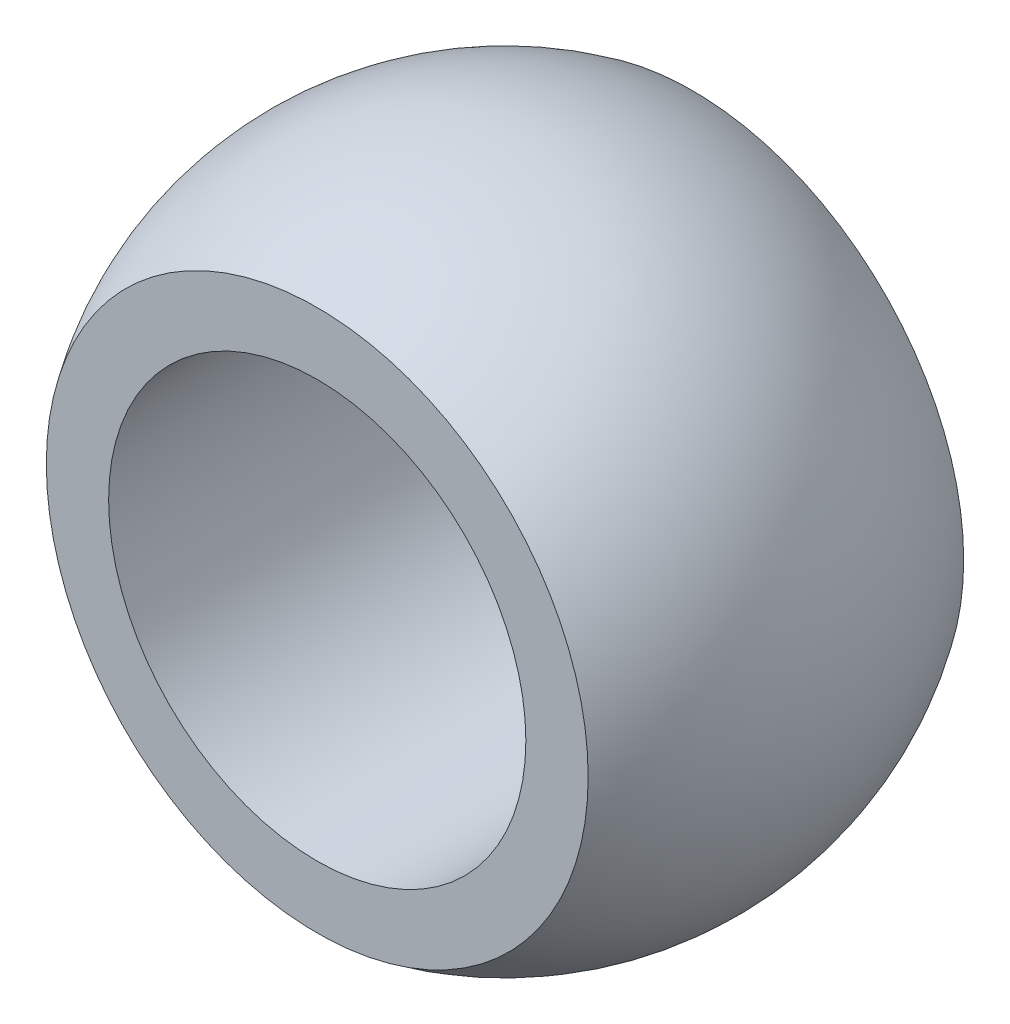
from build123d import *

# Parameters (mm, degrees)
CUT_EXTRUDE_1_DEPTH      = 10
CUT_EXTRUDE_1_DEPTH_BACK = 10
SKETCH_2_OUTSIDE_W       = 23.274
SKETCH_2_OUTSIDE_H       = 23.274
SKETCH_2_OUTSIDE_W_2     = 21.284245121
SKETCH_2_OUTSIDE_H_2     = 9
SKETCH_3_R               = 5
CUT_EXTRUDE_2_DEPTH      = 10


with BuildPart() as part:
    # 草图1 → 旋转1 (revolve)
    with BuildSketch(Plane(origin=(0, 0, 0), x_dir=(1, 0, 0), z_dir=(0, 1, 0))):
        with BuildLine():
            ThreePointArc((7.9, 0), (0, 7.9), (-7.9, 0))
            Line((-7.9, 0), (7.9, 0))
        make_face()
    revolve(axis=Axis((-7.9, 0, 0), (1, 0, 0)))

    # 草图2 outside → 切除-拉伸1 (cut, two sides: drawn at the far end of the back side and taken through both)
    with BuildSketch(Plane(origin=(0, 0, 0), x_dir=(1, 0, 0), z_dir=(0, 1, 0)).offset(-CUT_EXTRUDE_1_DEPTH_BACK)):
        Rectangle(SKETCH_2_OUTSIDE_W, SKETCH_2_OUTSIDE_H)
        with Locations((-0.394714959, 0)):
            Rectangle(SKETCH_2_OUTSIDE_W_2, SKETCH_2_OUTSIDE_H_2, mode=Mode.SUBTRACT)
    extrude(amount=CUT_EXTRUDE_1_DEPTH + CUT_EXTRUDE_1_DEPTH_BACK, mode=Mode.SUBTRACT)

    # 草图3 → 切除-拉伸2 (cut)
    with BuildSketch(Plane(origin=(0, 0, -4.5), x_dir=(-1, 0, 0), z_dir=(0, 0, -1))):
        Circle(SKETCH_3_R)
    extrude(amount=-CUT_EXTRUDE_2_DEPTH, mode=Mode.SUBTRACT)


solid = part.part
